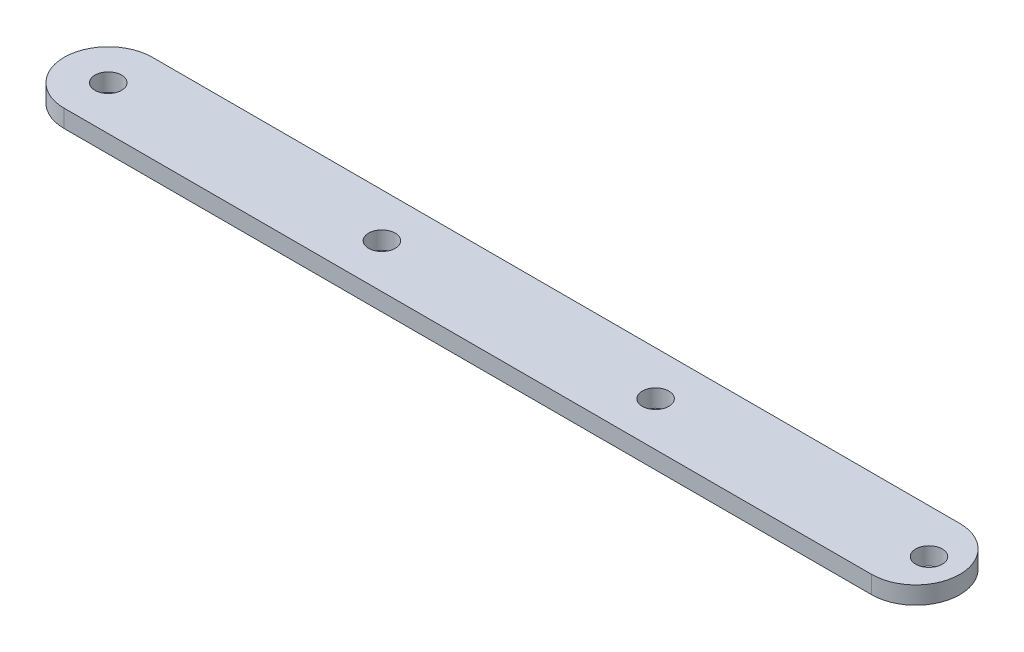
from build123d import *

# Parameters (mm, degrees)
SKETCH1_R           = 3.01
BOSS_EXTRUDE1_DEPTH = 4


with BuildPart() as part:
    # Sketch1 → Boss-Extrude1 (new body)
    with BuildSketch(Plane(origin=(0, 0, 0), x_dir=(1, 0, 0), z_dir=(0, 1, 0))):
        with BuildLine():
            Line((-124.1, 10), (58.99, 10))
            ThreePointArc((58.99, 10), (68.99, 0), (58.99, -10))
            Line((58.99, -10), (-124.1, -10))
            ThreePointArc((-124.1, -10), (-134.1, 0), (-124.1, 10))
        make_face()
        with Locations((-124.1, 0)):
            Circle(SKETCH1_R, mode=Mode.SUBTRACT)
        with Locations((-62.05, 0)):
            Circle(SKETCH1_R, mode=Mode.SUBTRACT)
        Circle(SKETCH1_R, mode=Mode.SUBTRACT)
        with Locations((62, 0)):
            Circle(SKETCH1_R, mode=Mode.SUBTRACT)
    extrude(amount=BOSS_EXTRUDE1_DEPTH)


solid = part.part
